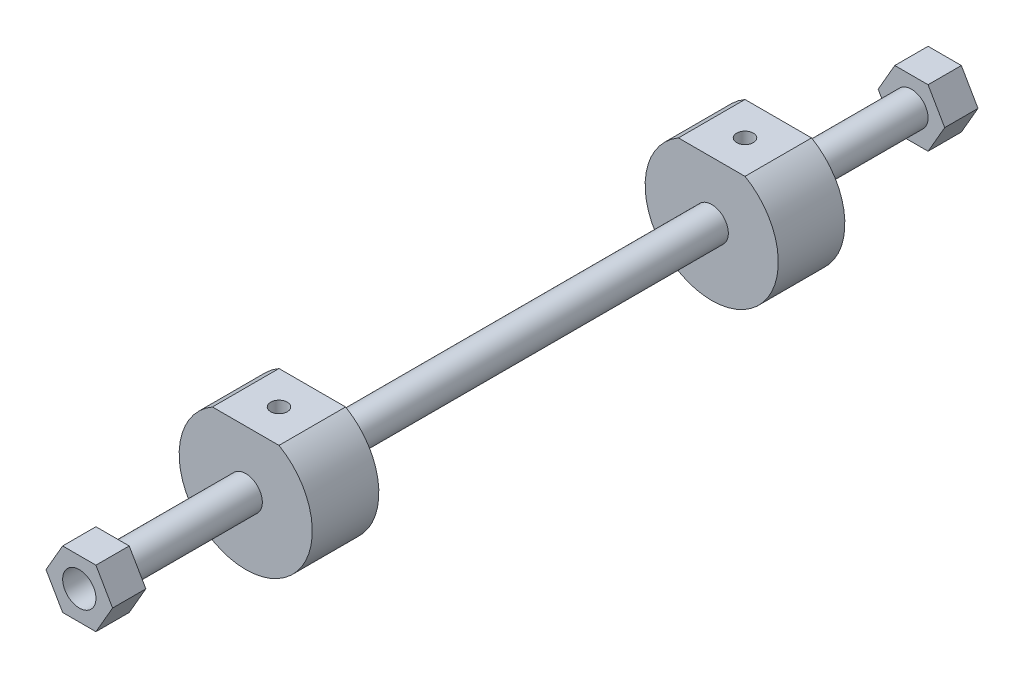
from build123d import *
from OCP.BRepAlgoAPI import BRepAlgoAPI_Cut
from OCP.TopTools import TopTools_ListOfShape

# Parameters (mm, degrees)
SKETCH1_R           = 6.35
BOSS_EXTRUDE1_DEPTH = 152.4
BOSS_EXTRUDE2_DEPTH = 12.7
SKETCH3_R           = 6.35
CUT_EXTRUDE1_DEPTH  = 12.7
BOSS_EXTRUDE3_DEPTH = 25.4
SKETCH5_R           = 3.175
CUT_EXTRUDE2_DEPTH  = 19.05
MIRROR1_START       = -101.6
MIRROR1_OUTLINE_R   = 6.35
MIRROR1_DEPTH       = 25.4
MIRROR1_START_2     = -165.1
MIRROR1_2_DEPTH     = 12.7
MIRROR1_START_3     = 5.499260123
MIRROR1_3_OUTLINE_R = 3.175
MIRROR1_3_DEPTH     = 16.497785133
MIRROR1_START_4     = -93
MIRROR1_4_DEPTH     = 7.275


with BuildPart() as part:
    # Sketch1 → Boss-Extrude1 (new, symmetric)
    with BuildSketch(Plane.XY):
        with Locations(Location((0, 0, 0), (0, 0, 180))):
            Circle(SKETCH1_R)
    extrude(amount=BOSS_EXTRUDE1_DEPTH, both=True)

    # Sketch2 → Boss-Extrude2 (add)
    with BuildSketch(Plane.XY.offset(152.4)):
        Polygon((6.35, -10.998522628), (12.7, 0), (6.35, 10.998522628), (-6.35, 10.998522628), (-12.7, 0), (-6.35, -10.998522628), align=None)
    extrude(amount=BOSS_EXTRUDE2_DEPTH)

    # Sketch3 → Cut-Extrude1 (cut)
    with BuildSketch(Plane.XY.offset(165.1)):
        with Locations(Location((0, 0, 0), (0, 0, 180))):
            Circle(SKETCH3_R)
    extrude(amount=-CUT_EXTRUDE1_DEPTH, mode=Mode.SUBTRACT)


with BuildPart() as cut_extrude1_piece_1:
    # of the separate pieces the step leaves, piece 1, a body of its own (cut_extrude1_pieces)
    add(part.part.solids().sort_by_distance((-6.35, 0, -152.4))[0])

    # Sketch4 → Boss-Extrude3 (add)
    with BuildSketch(Plane.XY.offset(76.2)):
        with BuildLine():
            Line((-12.7, 21.997045256), (12.7, 21.997045256))
            ThreePointArc((12.7, 21.997045256), (0, -25.4), (-12.7, 21.997045256))
        make_face()
    extrude(amount=BOSS_EXTRUDE3_DEPTH)

    # Sketch5 → Cut-Extrude2 (cut)
    with BuildSketch(Plane(origin=(0, 21.997045256, 0), x_dir=(1, 0, 0), z_dir=(0, 1, 0))):
        with Locations(Location((0, -88.9, 0), (0, 0, 270))):
            Circle(SKETCH5_R)
    extrude(amount=-CUT_EXTRUDE2_DEPTH, mode=Mode.SUBTRACT)


with BuildPart() as cut_extrude1_piece_2:
    # of the separate pieces the step leaves, piece 2, a body of its own (cut_extrude1_pieces)
    add(part.part.solids().sort_by_distance((6.35, -10.998522628, 152.4))[0])


with BuildPart() as mirror1_tool:
    # Mirror1: read off the stored shape, not the designer's step
    # Mirror1 outline → Mirror1 (new body)
    with BuildSketch(Plane.XY.offset(MIRROR1_START)):
        with BuildLine():
            Line((12.7, 21.997045256), (-12.7, 21.997045256))
            ThreePointArc((-12.7, 21.997045256), (0, -25.4), (12.7, 21.997045256))
        make_face()
        Circle(MIRROR1_OUTLINE_R, mode=Mode.SUBTRACT)
    extrude(amount=MIRROR1_DEPTH)


with BuildPart() as cut_extrude1_piece_1_1:
    add(cut_extrude1_piece_1.part)


with BuildPart() as cut_extrude1_piece_1_2:
    # Mirror1: joined with mirror1_tool
    add(cut_extrude1_piece_1_1.part.fuse(mirror1_tool.part, tol=0.00001))


with BuildPart() as mirror1_2_tool:
    # Mirror1 2 outline → Mirror1 2 (new body)
    with BuildSketch(Plane.XY.offset(MIRROR1_START_2)):
        Polygon((-12.7, 0), (-6.35, -10.998522628), (6.35, -10.998522628), (12.7, 0), (6.35, 10.998522628), (-6.35, 10.998522628), align=None)
    extrude(amount=MIRROR1_2_DEPTH)


with BuildPart() as cut_extrude1_piece_1_3:
    add(cut_extrude1_piece_1_2.part)


with BuildPart() as cut_extrude1_piece_1_4:
    # Mirror1 2: joined with mirror1_2_tool
    add(cut_extrude1_piece_1_3.part.fuse(mirror1_2_tool.part, tol=0.00001))


with BuildPart() as mirror1_3_tool:
    # Mirror1 3 outline → Mirror1 3 (new body)
    with BuildSketch(Plane(origin=(0, 0, 0), x_dir=(1, 0, 0), z_dir=(0, 1, 0)).offset(MIRROR1_START_3)):
        with Locations((0, 88.9)):
            Circle(MIRROR1_3_OUTLINE_R)
    extrude(amount=MIRROR1_3_DEPTH)


with BuildPart() as cut_extrude1_piece_1_5:
    add(cut_extrude1_piece_1_4.part)

    # Mirror1 3: cut by mirror1_3_tool, with a tolerance
    mirror1_3_stock = TopTools_ListOfShape()
    mirror1_3_stock.Append(cut_extrude1_piece_1_5.part.wrapped)
    mirror1_3_tools = TopTools_ListOfShape()
    mirror1_3_tools.Append(mirror1_3_tool.part.wrapped)
    mirror1_3_cut = BRepAlgoAPI_Cut()
    mirror1_3_cut.SetArguments(mirror1_3_stock)
    mirror1_3_cut.SetTools(mirror1_3_tools)
    mirror1_3_cut.SetFuzzyValue(0.00001)
    mirror1_3_cut.Build()
    add(Compound.cast(mirror1_3_cut.Shape()).solids(), mode=Mode.REPLACE)


with BuildPart() as mirror1_4_tool:
    # Mirror1 4 outline → Mirror1 4 (new body)
    with BuildSketch(Plane.XY.offset(MIRROR1_START_4)):
        with BuildLine():
            ThreePointArc((3.175000516, 5.499261016), (0, 6.35), (-3.175000515, 5.499261016))
            Line((-3.175000515, 5.499261016), (3.175000516, 5.499261016))
        make_face()
    extrude(amount=MIRROR1_4_DEPTH)


with BuildPart() as cut_extrude1_piece_1_6:
    add(cut_extrude1_piece_1_5.part)


with BuildPart() as cut_extrude1_piece_1_7:
    # Mirror1 4: joined with mirror1_4_tool
    add(cut_extrude1_piece_1_6.part.fuse(mirror1_4_tool.part, tol=0.00001))


solid = Compound([cut_extrude1_piece_2.part, cut_extrude1_piece_1_7.part])
